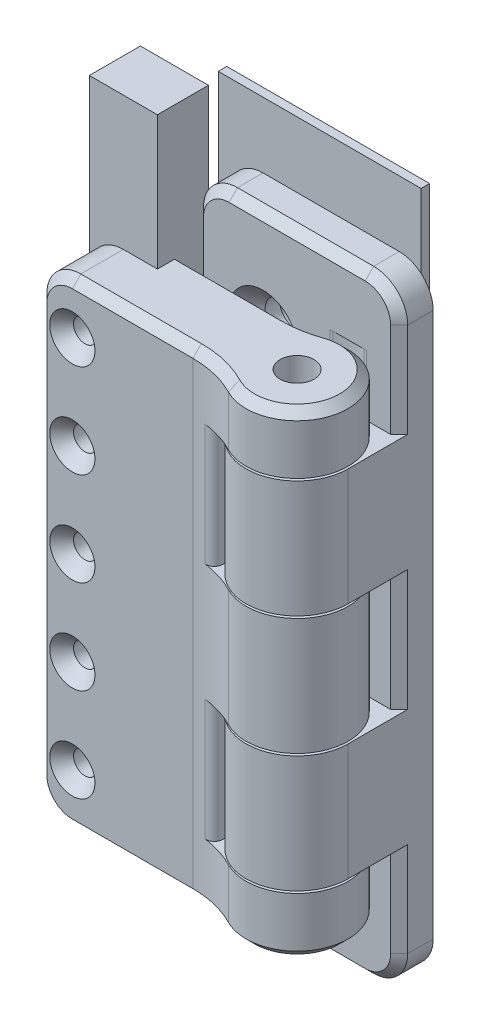
from build123d import *
from build123d.topology import SkipClean

# Parameters (mm, degrees)
SKETCH1_W                                     = 37.846
SKETCH1_H                                     = 114.3
BOSS_EXTRUDE1_DEPTH                           = 1.5875
SKETCH2_R                                     = 6.0706
CUT_EXTRUDE1_DEPTH                            = 69.563564466
CUT_EXTRUDE2_DEPTH                            = 69.563564466
BOSS_EXTRUDE2_REACH                           = 70.564
SKETCH4_W                                     = 12.7
SKETCH4_H                                     = 9.525
BOSS_EXTRUDE2_DIRECTION_2_REACH               = 70.564
SKETCH6_W                                     = 38.1
SKETCH6_H                                     = 114.3
BOSS_EXTRUDE3_DEPTH                           = 6.35
SKETCH7_R                                     = 5.5626
BOSS_EXTRUDE4_DEPTH                           = 3.175
FILLET2_R                                     = 0.762
CSK_FOR_1_4_FLAT_HEAD_MACHINE_SCREW1_AT_COUNT = 2
CSK_FOR_1_4_FLAT_HEAD_MACHINE_SCREW1_AT_PITCH = 38.1
CSK_FOR_1_4_FLAT_HEAD_MACHINE_SCREW1_2_COUNT  = 2
CSK_FOR_1_4_FLAT_HEAD_MACHINE_SCREW1_2_PITCH  = 76.2
BOSS_EXTRUDE8_DEPTH                           = 44.45
BOSS_EXTRUDE9_DEPTH                           = 44.45
BOSS_EXTRUDE12_DEPTH                          = 88.9
CSK_FOR_8_FLAT_HEAD_MACHINE_SCREW2_AT_2_COUNT = 2
CSK_FOR_8_FLAT_HEAD_MACHINE_SCREW2_AT_2_PITCH = 17.4625
CSK_FOR_8_FLAT_HEAD_MACHINE_SCREW2_AT_3_COUNT = 2
CSK_FOR_8_FLAT_HEAD_MACHINE_SCREW2_AT_3_PITCH = 34.925
CSK_FOR_8_FLAT_HEAD_MACHINE_SCREW2_AT_4_COUNT = 2
CSK_FOR_8_FLAT_HEAD_MACHINE_SCREW2_AT_4_PITCH = 52.3875
CSK_FOR_8_FLAT_HEAD_MACHINE_SCREW2_AT_5_COUNT = 2
CSK_FOR_8_FLAT_HEAD_MACHINE_SCREW2_AT_5_PITCH = 69.85
SKETCH20_R                                    = 3.175
CUT_EXTRUDE6_DEPTH                            = 85.725
SKETCH23_W                                    = 19.05
SKETCH23_H                                    = 11.1125
BOSS_EXTRUDE10_DEPTH                          = 19.05
SKETCH23_H_2                                  = 22.225
BOSS_EXTRUDE10_2_DEPTH                        = 19.05
BOSS_EXTRUDE10_3_DEPTH                        = 19.05
SKETCH24_R                                    = 10.033
BOSS_EXTRUDE11_DEPTH                          = 11.1125
LPATTERN3_COUNT                               = 3
LPATTERN3_PITCH                               = 22.225
LPATTERN3_2_COUNT                             = 3
LPATTERN3_2_PITCH                             = 22.225
SKETCH25_OUTSIDE_W                            = 81.954
SKETCH25_OUTSIDE_H                            = 156.515
SKETCH25_OUTSIDE_W_2                          = 51.9811
SKETCH25_OUTSIDE_H_2                          = 88.9
CUT_EXTRUDE7_DEPTH                            = 85.475623046
FILLET7_R                                     = 1.5875
FILLET8_R                                     = 1.5875
FILLET5_R                                     = 6.35
FILLET6_R                                     = 6.35
CHAMFER5_SIZE                                 = 1.5875
CHAMFER6_SIZE                                 = 1.5875
MOVE_START                                    = -23.5553
MOVE_FACE3_OUTLINE_R                          = 3.175
MOVE_FACE3_DEPTH                              = 22.625
MOVE_START_2                                  = -45.5803
MOVE_FACE3_2_OUTLINE_R                        = 3.175
MOVE_FACE3_2_DEPTH                            = 0.2
MOVE_START_3                                  = 20.8947
MOVE_FACE3_3_OUTLINE_R                        = 3.175
MOVE_FACE3_3_DEPTH                            = 0.2
MOVE_START_4                                  = -45.7803
MOVE_FACE4_OUTLINE_R                          = 3.175
MOVE_FACE4_DEPTH                              = 22.625
MOVE_START_5                                  = -1.3303
MOVE_FACE4_2_OUTLINE_R                        = 3.175
MOVE_FACE4_2_DEPTH                            = 22.625


with BuildPart() as part:
    # Sketch1 → Boss-Extrude1 (new body)
    with BuildSketch(Plane.XY):
        with Locations((18.923, 0)):
            Rectangle(SKETCH1_W, SKETCH1_H)
    extrude(amount=-BOSS_EXTRUDE1_DEPTH)

    # Sketch2 → Cut-Extrude1 (cut, through all)
    with BuildSketch(Plane.XY):
        with Locations((14.7066, 38.1254)):
            Circle(SKETCH2_R)
        with Locations((14.7066, 0.0254)):
            Circle(SKETCH2_R)
        with Locations((14.7066, -38.0746)):
            Circle(SKETCH2_R)
    extrude(amount=-CUT_EXTRUDE1_DEPTH, mode=Mode.SUBTRACT)

    # Sketch3 → Cut-Extrude2 (cut, through all)
    with BuildSketch(Plane.XY):
        with BuildLine():
            Line((18.4912, 38.1254), (18.4912, 25.8572))
            ThreePointArc((18.4912, 25.8572), (14.7066, 22.0726), (10.922, 25.8572))
            Line((10.922, 25.8572), (10.922, 38.1254))
            ThreePointArc((10.922, 38.1254), (14.7066, 41.91), (18.4912, 38.1254))
        make_face()
        with BuildLine():
            Line((18.4912, 0.0254), (18.4912, -12.2428))
            ThreePointArc((18.4912, -12.2428), (14.7066, -16.0274), (10.922, -12.2428))
            Line((10.922, -12.2428), (10.922, 0.0254))
            ThreePointArc((10.922, 0.0254), (14.7066, 3.81), (18.4912, 0.0254))
        make_face()
        with BuildLine():
            Line((18.4912, -38.0746), (18.4912, -50.3428))
            ThreePointArc((18.4912, -50.3428), (14.7066, -54.1274), (10.922, -50.3428))
            Line((10.922, -50.3428), (10.922, -38.0746))
            ThreePointArc((10.922, -38.0746), (14.7066, -34.29), (18.4912, -38.0746))
        make_face()
    extrude(amount=-CUT_EXTRUDE2_DEPTH, mode=Mode.SUBTRACT)


with BuildPart() as body_2:

    # Boss-Extrude2: up to this face of the body (flat: up to its plane)
    boss_extrude2_end = Plane(part.part.faces().sort_by_distance((18.923, 57.15, -0.79375))[0])
    # Sketch4 → Boss-Extrude2 (new, up to the picked face)
    with BuildSketch(Plane(origin=(0, 0, 0), x_dir=(1, 0, 0), z_dir=(0, 1, 0)), mode=Mode.PRIVATE) as boss_extrude2_sk1:
        with Locations((-5.0165, -7.9375)):
            Rectangle(SKETCH4_W, SKETCH4_H)
    boss_extrude2_tool1 = split(extrude(boss_extrude2_sk1.sketch, amount=BOSS_EXTRUDE2_REACH, mode=Mode.PRIVATE), bisect_by=boss_extrude2_end, keep=Keep.BOTH, mode=Mode.PRIVATE)
    add(boss_extrude2_tool1.solids().sort_by(Axis((-5.0165, 0, 7.9375), (0, 1, 0)))[0])


    # Boss-Extrude2 direction 2: up to this face of the body (flat: up to its plane)
    boss_extrude2_direction_2_end = Plane(part.part.faces().sort_by_distance((18.923, -57.15, -0.79375))[0])
    # Sketch4 → Boss-Extrude2 direction 2 (add, up to the picked face)
    with BuildSketch(Plane(origin=(0, 0, 0), x_dir=(1, 0, 0), z_dir=(0, 1, 0)), mode=Mode.PRIVATE) as boss_extrude2_direction_2_sk1:
        with Locations((-5.0165, -7.9375)):
            Rectangle(SKETCH4_W, SKETCH4_H)
    boss_extrude2_direction_2_tool1 = split(extrude(boss_extrude2_direction_2_sk1.sketch, amount=-BOSS_EXTRUDE2_DIRECTION_2_REACH, mode=Mode.PRIVATE), bisect_by=boss_extrude2_direction_2_end, keep=Keep.BOTH, mode=Mode.PRIVATE)
    add(boss_extrude2_direction_2_tool1.solids().sort_by(Axis((-5.0165, 0, 7.9375), (0, -1, 0)))[0])


with BuildPart() as body_3:
    # Sketch6 → Boss-Extrude3 (new body)
    with BuildSketch(Plane.XY):
        with Locations((21.0566, -12.2428)):
            Rectangle(SKETCH6_W, SKETCH6_H)
    extrude(amount=BOSS_EXTRUDE3_DEPTH)

    # Sketch7 → Boss-Extrude4 (add)
    with BuildSketch(Plane(origin=(0, 0, 0), x_dir=(-1, 0, 0), z_dir=(0, 0, -1))):
        with Locations((-14.7066, 0.0254)):
            Circle(SKETCH7_R)
        with Locations((-14.7066, -38.0746)):
            Circle(SKETCH7_R)
        with Locations((-14.7066, 38.1254)):
            Circle(SKETCH7_R)
    extrude(amount=BOSS_EXTRUDE4_DEPTH)

    # Fillet2
    fillet2_edges = [body_3.edges().sort_by_distance(p)[0] for p in [
        (20.2692, 0.0254, 0),
        (20.2692, -38.0746, 0),
        (20.2692, 38.1254, 0),
    ]]
    fillet(fillet2_edges, radius=FILLET2_R)

    # Sketch9 → CSK for 1/4 Flat Head Machine Screw1 (revolve, cut)
    with BuildSketch(Plane(origin=(14.7066, 25.8572, 6.35), x_dir=(0, -1, 0), z_dir=(1, 0, 0))):
        Polygon((0, 0), (0, 9.525), (3.2639, 9.525), (3.2639, 3.652419693), (6.4389, 0), align=None)
    csk_for_1_4_flat_head_machine_screw1 = revolve(axis=Axis((14.7066, 25.8572, 12.7), (0, 0, -1)), mode=Mode.SUBTRACT)

    # CSK for 1/4 Flat Head Machine Screw1 at: CSK for 1/4 Flat Head Machine Screw1 ×2
    with Locations(*[(0, -i * CSK_FOR_1_4_FLAT_HEAD_MACHINE_SCREW1_AT_PITCH, 0) for i in range(1, CSK_FOR_1_4_FLAT_HEAD_MACHINE_SCREW1_AT_COUNT)]):
        add(csk_for_1_4_flat_head_machine_screw1, mode=Mode.SUBTRACT)

    # CSK for 1_4 Flat Head Machine Screw1 2: CSK for 1/4 Flat Head Machine Screw1 ×2
    with Locations(*[(0, -i * CSK_FOR_1_4_FLAT_HEAD_MACHINE_SCREW1_2_PITCH, 0) for i in range(1, CSK_FOR_1_4_FLAT_HEAD_MACHINE_SCREW1_2_COUNT)]):
        add(csk_for_1_4_flat_head_machine_screw1, mode=Mode.SUBTRACT)

    # Sketch18 → Boss-Extrude8 (add, symmetric)
    with BuildSketch(Plane(origin=(0, -12.2428, 0), x_dir=(1, 0, 0), z_dir=(0, 1, 0))):
        with BuildLine():
            Line((21.0566, -6.35), (21.0566, -15.875))
            ThreePointArc((21.0566, -15.875), (30.5816, -25.4), (40.1066, -15.875))
            Line((40.1066, -15.875), (40.1066, -6.35))
            Line((40.1066, -6.35), (21.0566, -6.35))
        make_face()
    extrude(amount=BOSS_EXTRUDE8_DEPTH, both=True)


with BuildPart() as body_4:
    # Sketch19 → Boss-Extrude9 (new, symmetric)
    with BuildSketch(Plane(origin=(0, -12.2428, 0), x_dir=(1, 0, 0), z_dir=(0, 1, 0))):
        with BuildLine():
            Line((-11.3665, -12.7), (-11.3665, -22.225))
            Line((-11.3665, -22.225), (17.490739639, -22.225))
            ThreePointArc((17.490739639, -22.225), (21.980867699, -22.761727734), (26.21797988, -24.341666667))
            ThreePointArc((26.21797988, -24.341666667), (40.057194918, -14.906121289), (24.594762586, -8.466666667))
            ThreePointArc((24.594762586, -8.466666667), (18.971087758, -11.610512242), (12.621087758, -12.7))
            Line((12.621087758, -12.7), (-11.3665, -12.7))
        make_face()
    extrude(amount=BOSS_EXTRUDE9_DEPTH, both=True)

    # Sketch26 → Boss-Extrude12 (add)
    with BuildSketch(Plane(origin=(0, 32.2072, 0), x_dir=(1, 0, 0), z_dir=(0, 1, 0))):
        with BuildLine():
            Line((1.3335, -15.875), (1.3335, -7.9375))
            Line((1.3335, -7.9375), (21.189823344, -7.9375))
            ThreePointArc((21.189823344, -7.9375), (24.364823344, -7.671053311), (27.451007781, -6.879166667))
            Line((27.451007781, -6.879166667), (30.5816, -15.875))
            Line((30.5816, -15.875), (1.3335, -15.875))
        make_face()
    extrude(amount=-BOSS_EXTRUDE12_DEPTH)


with BuildPart() as csk_for_8_flat_head_machine_screw2_tool:
    # Sketch22 → CSK for #8 Flat Head Machine Screw2 (revolve)
    with BuildSketch(Plane(origin=(-5.0165, -47.1678, 22.225), x_dir=(0, -1, 0), z_dir=(1, 0, 0))):
        Polygon((0, 0), (0, 25.4), (2.15265, 25.4), (2.15265, 2.3740728), (4.2164, 0), align=None)
    csk_for_8_flat_head_machine_screw2 = revolve(axis=Axis((-5.0165, -47.1678, 28.575), (0, 0, -1)))


with BuildPart() as body_2_1:
    add(body_2.part)

    # CSK for #8 Flat Head Machine Screw2: cut by csk_for_8_flat_head_machine_screw2_tool
    add(csk_for_8_flat_head_machine_screw2_tool.part, mode=Mode.SUBTRACT)


with BuildPart() as body_4_1:
    add(body_4.part)

    # CSK for #8 Flat Head Machine Screw2: cut by csk_for_8_flat_head_machine_screw2_tool
    add(csk_for_8_flat_head_machine_screw2_tool.part, mode=Mode.SUBTRACT)


with BuildPart() as csk_for_8_flat_head_machine_screw2_at_2_tool:
    # CSK for #8 Flat Head Machine Screw2 at 2: CSK for #8 Flat Head Machine Screw2 ×2
    with Locations(*[(0, i * CSK_FOR_8_FLAT_HEAD_MACHINE_SCREW2_AT_2_PITCH, 0) for i in range(1, CSK_FOR_8_FLAT_HEAD_MACHINE_SCREW2_AT_2_COUNT)]):
        add(csk_for_8_flat_head_machine_screw2)


with BuildPart() as body_2_2:
    add(body_2_1.part)

    # CSK for #8 Flat Head Machine Screw2 at 2: cut by csk_for_8_flat_head_machine_screw2_at_2_tool
    add(csk_for_8_flat_head_machine_screw2_at_2_tool.part, mode=Mode.SUBTRACT)


with BuildPart() as body_4_2:
    add(body_4_1.part)

    # CSK for #8 Flat Head Machine Screw2 at 2: cut by csk_for_8_flat_head_machine_screw2_at_2_tool
    add(csk_for_8_flat_head_machine_screw2_at_2_tool.part, mode=Mode.SUBTRACT)


with BuildPart() as csk_for_8_flat_head_machine_screw2_at_3_tool:
    # CSK for #8 Flat Head Machine Screw2 at 3: CSK for #8 Flat Head Machine Screw2 ×2
    with Locations(*[(0, i * CSK_FOR_8_FLAT_HEAD_MACHINE_SCREW2_AT_3_PITCH, 0) for i in range(1, CSK_FOR_8_FLAT_HEAD_MACHINE_SCREW2_AT_3_COUNT)]):
        add(csk_for_8_flat_head_machine_screw2)


with BuildPart() as body_2_3:
    add(body_2_2.part)

    # CSK for #8 Flat Head Machine Screw2 at 3: cut by csk_for_8_flat_head_machine_screw2_at_3_tool
    add(csk_for_8_flat_head_machine_screw2_at_3_tool.part, mode=Mode.SUBTRACT)


with BuildPart() as body_4_3:
    add(body_4_2.part)

    # CSK for #8 Flat Head Machine Screw2 at 3: cut by csk_for_8_flat_head_machine_screw2_at_3_tool
    add(csk_for_8_flat_head_machine_screw2_at_3_tool.part, mode=Mode.SUBTRACT)


with BuildPart() as csk_for_8_flat_head_machine_screw2_at_4_tool:
    # CSK for #8 Flat Head Machine Screw2 at 4: CSK for #8 Flat Head Machine Screw2 ×2
    with Locations(*[(0, i * CSK_FOR_8_FLAT_HEAD_MACHINE_SCREW2_AT_4_PITCH, 0) for i in range(1, CSK_FOR_8_FLAT_HEAD_MACHINE_SCREW2_AT_4_COUNT)]):
        add(csk_for_8_flat_head_machine_screw2)


with BuildPart() as body_2_4:
    add(body_2_3.part)

    # CSK for #8 Flat Head Machine Screw2 at 4: cut by csk_for_8_flat_head_machine_screw2_at_4_tool
    add(csk_for_8_flat_head_machine_screw2_at_4_tool.part, mode=Mode.SUBTRACT)


with BuildPart() as body_4_4:
    add(body_4_3.part)

    # CSK for #8 Flat Head Machine Screw2 at 4: cut by csk_for_8_flat_head_machine_screw2_at_4_tool
    add(csk_for_8_flat_head_machine_screw2_at_4_tool.part, mode=Mode.SUBTRACT)


with BuildPart() as csk_for_8_flat_head_machine_screw2_at_5_tool:
    # CSK for #8 Flat Head Machine Screw2 at 5: CSK for #8 Flat Head Machine Screw2 ×2
    with Locations(*[(0, i * CSK_FOR_8_FLAT_HEAD_MACHINE_SCREW2_AT_5_PITCH, 0) for i in range(1, CSK_FOR_8_FLAT_HEAD_MACHINE_SCREW2_AT_5_COUNT)]):
        add(csk_for_8_flat_head_machine_screw2)


with BuildPart() as body_2_5:
    add(body_2_4.part)

    # CSK for #8 Flat Head Machine Screw2 at 5: cut by csk_for_8_flat_head_machine_screw2_at_5_tool
    add(csk_for_8_flat_head_machine_screw2_at_5_tool.part, mode=Mode.SUBTRACT)


with BuildPart() as body_4_5:
    add(body_4_4.part)

    # CSK for #8 Flat Head Machine Screw2 at 5: cut by csk_for_8_flat_head_machine_screw2_at_5_tool
    add(csk_for_8_flat_head_machine_screw2_at_5_tool.part, mode=Mode.SUBTRACT)


with BuildPart() as cut_extrude6_tool:
    # Sketch20 → Cut-Extrude6 (new body)
    with BuildSketch(Plane(origin=(0, 32.2072, 0), x_dir=(1, 0, 0), z_dir=(0, 1, 0))):
        with Locations(Location((30.5816, -15.875, 0), (0, 0, 180))):
            Circle(SKETCH20_R)
    extrude(amount=-CUT_EXTRUDE6_DEPTH)


with BuildPart() as body_3_1:
    add(body_3.part)

    # Cut-Extrude6: cut by cut_extrude6_tool
    add(cut_extrude6_tool.part, mode=Mode.SUBTRACT)


with BuildPart() as body_4_6:
    add(body_4_5.part)

    # Cut-Extrude6: cut by cut_extrude6_tool
    add(cut_extrude6_tool.part, mode=Mode.SUBTRACT)


with BuildPart() as body_5:
    # Sketch23 → Boss-Extrude10 (new body)
    with BuildSketch(Plane.XY.offset(6.35)):
        with Locations((30.5816, 26.65095)):
            Rectangle(SKETCH23_W, SKETCH23_H)
    extrude(amount=BOSS_EXTRUDE10_DEPTH)


with BuildPart() as body_6:
    # Sketch23 → Boss-Extrude10 2 (new body)
    with BuildSketch(Plane.XY.offset(6.35)):
        with Locations((30.5816, -12.2428)):
            Rectangle(SKETCH23_W, SKETCH23_H_2)
    extrude(amount=BOSS_EXTRUDE10_2_DEPTH)


with BuildPart() as body_7:
    # Sketch23 → Boss-Extrude10 3 (new body)
    with BuildSketch(Plane.XY.offset(6.35)):
        with Locations((30.5816, -51.13655)):
            Rectangle(SKETCH23_W, SKETCH23_H)
    extrude(amount=BOSS_EXTRUDE10_3_DEPTH)


with BuildPart() as body_3_2:
    add(body_3_1.part)

    # Intersect1: read off the stored shape, not the designer's step
    # Intersect1: cut body 7, body 6, body 5
    add(body_7.part, mode=Mode.SUBTRACT)
    add(body_6.part, mode=Mode.SUBTRACT)
    add(body_5.part, mode=Mode.SUBTRACT)


with BuildPart() as body_5_2:
    # Sketch24 → Boss-Extrude11 (new, symmetric)
    with BuildSketch(Plane(origin=(0, -12.2428, 0), x_dir=(1, 0, 0), z_dir=(0, 1, 0))):
        with Locations(Location((30.5816, -15.875, 0), (0, 0, 180))):
            Circle(SKETCH24_R)
    extrude(amount=BOSS_EXTRUDE11_DEPTH, both=True)


with BuildPart() as lpattern3_1:
    # LPattern3: pattern copy
    add(body_5_2.part.moved(Location(Vector(0, 1, 0) * (1 * LPATTERN3_PITCH))))


with BuildPart() as lpattern3_2:
    # LPattern3: pattern copy
    add(body_5_2.part.moved(Location(Vector(0, 1, 0) * (2 * LPATTERN3_PITCH))))


with BuildPart() as lpattern3_2_1:
    # LPattern3 2: pattern copy
    add(body_5_2.part.moved(Location(Vector(0, -1, 0) * (1 * LPATTERN3_2_PITCH))))


with BuildPart() as lpattern3_2_2:
    # LPattern3 2: pattern copy
    add(body_5_2.part.moved(Location(Vector(0, -1, 0) * (2 * LPATTERN3_2_PITCH))))


with BuildPart() as cut_extrude7_tool:
    # Sketch25 outside → Cut-Extrude7 (new, through all)
    with BuildSketch(Plane.XY):
        with Locations((14.624, -6.1215)):
            Rectangle(SKETCH25_OUTSIDE_W, SKETCH25_OUTSIDE_H)
        with Locations((14.62405, -12.2428)):
            Rectangle(SKETCH25_OUTSIDE_W_2, SKETCH25_OUTSIDE_H_2, mode=Mode.SUBTRACT)
    extrude(amount=CUT_EXTRUDE7_DEPTH)


with BuildPart() as lpattern3_2_3:
    add(lpattern3_2.part)

    # Cut-Extrude7: cut by cut_extrude7_tool
    add(cut_extrude7_tool.part, mode=Mode.SUBTRACT)


with BuildPart() as lpattern3_2_2_1:
    add(lpattern3_2_2.part)

    # Cut-Extrude7: cut by cut_extrude7_tool
    add(cut_extrude7_tool.part, mode=Mode.SUBTRACT)


with BuildPart() as body_3_3:
    add(body_3_2.part)

    # Intersect2: read off the stored shape, not the designer's step
    # Intersect2: cut LPattern3 2_2, body 5 2, LPattern3_2
    add(lpattern3_2_2_1.part, mode=Mode.SUBTRACT)
    add(body_5_2.part, mode=Mode.SUBTRACT)
    add(lpattern3_2_3.part, mode=Mode.SUBTRACT)

    # Fillet8
    fillet8_edges = [body_3_3.edges().sort_by_distance(p)[0] for p in [
        (33.733657106, 26.65095, 6.35),
        (27.429542894, 26.65095, 6.35),
        (33.733657106, -12.2428, 6.35),
        (27.429542894, -12.2428, 6.35),
        (33.733657106, -51.13655, 6.35),
        (27.429542894, -51.13655, 6.35),
    ]]
    fillet(fillet8_edges, radius=FILLET8_R)

    # Fillet5
    fillet5_edges = [body_3_3.edges().sort_by_distance(p)[0] for p in [
        (40.1066, 44.9072, 3.175),
        (2.0066, 44.9072, 3.175),
        (2.0066, -69.3928, 3.175),
        (40.1066, -69.3928, 3.175),
    ]]
    fillet(fillet5_edges, radius=FILLET5_R)

    # Chamfer6
    chamfer6_edges = [body_3_3.edges().sort_by_distance(p)[0] for p in [
        (21.0566, -69.3928, 6.35),
        (2.0066, -12.2428, 6.35),
        (21.0566, 44.9072, 6.35),
        (40.1066, -54.31155, 6.35),
        (38.246728061, 43.047328061, 6.35),
        (3.866471939, 43.047328061, 6.35),
        (38.246728061, -67.532928061, 6.35),
        (3.866471939, -67.532928061, 6.35),
        (40.1066, -12.2428, 6.35),
        (40.1066, 29.82595, 6.35),
    ]]
    chamfer(chamfer6_edges, length=CHAMFER6_SIZE)

    # Move Face3: read off the stored shape, not the designer's step
    # Move Face3 outline → Move Face3 (cut)
    with BuildSketch(Plane(origin=(0, 0, 0), x_dir=(1, 0, 0), z_dir=(0, 1, 0)).offset(MOVE_START)):
        with BuildLine():
            ThreePointArc((33.515641345, -6.280601093), (30.5816, -5.842), (27.647558655, -6.280601093))
            ThreePointArc((27.647558655, -6.280601093), (27.41801436, -6.332554415), (27.183311607, -6.35))
            Line((27.183311607, -6.35), (21.0566, -6.35))
            Line((21.0566, -6.35), (21.0566, -15.875))
            ThreePointArc((21.0566, -15.875), (30.5816, -25.4), (40.1066, -15.875))
            Line((40.1066, -15.875), (40.1066, -4.7625))
            Line((40.1066, -4.7625), (38.5191, -6.35))
            Line((38.5191, -6.35), (33.979888393, -6.35))
            ThreePointArc((33.979888393, -6.35), (33.74518564, -6.332554415), (33.515641345, -6.280601093))
        make_face()
        with Locations((30.5816, -15.875)):
            Circle(MOVE_FACE3_OUTLINE_R, mode=Mode.SUBTRACT)
    extrude(amount=MOVE_FACE3_DEPTH, mode=Mode.SUBTRACT)

    # Move Face3 2 outline → Move Face3 2 (cut)
    with BuildSketch(Plane(origin=(0, 0, 0), x_dir=(1, 0, 0), z_dir=(0, 1, 0)).offset(MOVE_START_2)):
        with BuildLine():
            ThreePointArc((33.515641345, -6.280601093), (30.5816, -5.842), (27.647558655, -6.280601093))
            ThreePointArc((27.647558655, -6.280601093), (27.41801436, -6.332554415), (27.183311607, -6.35))
            Line((27.183311607, -6.35), (21.0566, -6.35))
            Line((21.0566, -6.35), (21.0566, -15.875))
            ThreePointArc((21.0566, -15.875), (30.5816, -25.4), (40.1066, -15.875))
            Line((40.1066, -15.875), (40.1066, -4.7625))
            Line((40.1066, -4.7625), (38.5191, -6.35))
            Line((38.5191, -6.35), (33.979888393, -6.35))
            ThreePointArc((33.979888393, -6.35), (33.74518564, -6.332554415), (33.515641345, -6.280601093))
        make_face()
        with Locations((30.5816, -15.875)):
            Circle(MOVE_FACE3_2_OUTLINE_R, mode=Mode.SUBTRACT)
    extrude(amount=MOVE_FACE3_2_DEPTH, mode=Mode.SUBTRACT)

    # Move Face3 3 outline → Move Face3 3 (cut)
    with BuildSketch(Plane(origin=(0, 0, 0), x_dir=(1, 0, 0), z_dir=(0, 1, 0)).offset(MOVE_START_3)):
        with BuildLine():
            ThreePointArc((33.515641345, -6.280601093), (30.5816, -5.842), (27.647558655, -6.280601093))
            ThreePointArc((27.647558655, -6.280601093), (27.41801436, -6.332554415), (27.183311607, -6.35))
            Line((27.183311607, -6.35), (21.0566, -6.35))
            Line((21.0566, -6.35), (21.0566, -15.875))
            ThreePointArc((21.0566, -15.875), (30.5816, -25.4), (40.1066, -15.875))
            Line((40.1066, -15.875), (40.1066, -4.7625))
            Line((40.1066, -4.7625), (38.5191, -6.35))
            Line((38.5191, -6.35), (33.979888393, -6.35))
            ThreePointArc((33.979888393, -6.35), (33.74518564, -6.332554415), (33.515641345, -6.280601093))
        make_face()
        with Locations((30.5816, -15.875)):
            Circle(MOVE_FACE3_3_OUTLINE_R, mode=Mode.SUBTRACT)
    extrude(amount=MOVE_FACE3_3_DEPTH, mode=Mode.SUBTRACT)


with BuildPart() as body_4_7:
    add(body_4_6.part)

    # Intersect3: read off the stored shape, not the designer's step
    # Intersect3: cut LPattern3 2_1, LPattern3_1
    add(lpattern3_2_1.part, mode=Mode.SUBTRACT)
    add(lpattern3_1.part, mode=Mode.SUBTRACT)

    # Fillet7
    # the kernel refuses this fillet: 1.5875 mm, written as the material it takes off along each edge
    with BuildSketch(Plane(origin=(24.968756894, -45.5803, 7.558926331), x_dir=(-0.7015732440189187, 0, 0.7125973500349062), z_dir=(0, 1, 0)), Plane(origin=(24.968756894, -1.1303, 7.558926331), x_dir=(-0.7015732440189183, 0, 0.7125973500349067), z_dir=(0, 1, 0))) as fillet7_piece_1:
        with BuildLine():
            CenterArc((4.290970292, -1.556017706), FILLET7_R, 101.429685754, 123.123676509)
            Line((3.159721999, -2.669765231), (3.04659717, -2.781139984))
            ThreePointArc((3.04659717, -2.781139984), (2.807844434, -2.538635629), (-0.088783419, -0.131601926))
            Line((-0.088783419, -0.131601926), (0.031458726, 0.155601771))
            ThreePointArc((0.031458726, 0.155601771), (1.988191514, -0.040218095), (3.944924301, 0.155601771))
            Line((3.944924301, 0.155601771), (3.976383027, 0))
        make_face()
    extrude(amount=22.225, mode=Mode.SUBTRACT)
    with BuildSketch(Plane(origin=(23.855877584, -1.1303, 23.319847009), x_dir=(-0.594593054161878, 0, -0.8040268030000305), z_dir=(0, 1, 0)), Plane(origin=(23.855877584, -45.5803, 23.319847009), x_dir=(-0.5945930541618822, 0, -0.8040268030000275), z_dir=(0, 1, 0))) as fillet7_piece_2:
        with BuildLine():
            CenterArc((4.287942715, 1.556062565), FILLET7_R, 136.378278382, 122.200208886)
            ThreePointArc((3.13873501, 2.65126935), (1.641053557, 1.240768337), (0, 0))
            ThreePointArc((0, 0), (1.986788707, 0.198684587), (3.973577413, 0))
        make_face()
    extrude(amount=22.225, mode=Mode.SUBTRACT)

    # Fillet6
    fillet6_edges = [body_4_7.edges().sort_by_distance(p)[0] for p in [
        (-11.3665, -56.6928, 17.4625),
        (-11.3665, 32.2072, 17.4625),
    ]]
    fillet(fillet6_edges, radius=FILLET6_R)

    # Chamfer5
    chamfer5_edges = [body_4_7.edges().sort_by_distance(p)[0] for p in [
        (6.237119819, 32.2072, 22.225),
        (6.237119819, -56.6928, 22.225),
        (-11.3665, -12.2428, 22.225),
        (-9.506628061, -54.832928061, 22.225),
        (-9.506628061, 30.347328061, 22.225),
        (24.364823344, 32.2072, 7.671053311),
        (11.261661672, 32.2072, 7.9375),
        (24.364823344, -56.6928, 7.671053311),
        (11.261661672, -56.6928, 7.9375),
        (21.980867699, -56.6928, 22.761727734),
        (40.082943653, -56.6928, 16.545890298),
        (21.980867699, 32.2072, 22.761727734),
        (40.082943653, 32.2072, 16.545890298),
    ]]
    chamfer(chamfer5_edges, length=CHAMFER5_SIZE)

    # Move Face4: read off the stored shape, not the designer's step
    # Move Face4 outline → Move Face4 (cut)
    with SkipClean():  # the faces are left unmerged after this step: merging them gives an invalid solid
        with BuildSketch(Plane(origin=(0, 0, 0), x_dir=(1, 0, 0), z_dir=(0, 1, 0)).offset(MOVE_START_4)):
            with BuildLine():
                ThreePointArc((27.451007781, -6.879166667), (24.364823344, -7.671053311), (21.189823344, -7.9375))
                Line((21.189823344, -7.9375), (20.849512852, -7.9375))
                ThreePointArc((20.849512852, -7.9375), (22.24545175, -8.769016638), (22.179032954, -10.392486339))
                ThreePointArc((22.179032954, -10.392486339), (20.573417317, -15.169756508), (21.493216054, -20.124984265))
                ThreePointArc((21.493216054, -20.124984265), (21.338876119, -21.731410575), (19.857915929, -22.372646273))
                ThreePointArc((19.857915929, -22.372646273), (23.12463526, -23.077150673), (26.21797988, -24.341666667))
                ThreePointArc((26.21797988, -24.341666667), (40.082943653, -16.545890298), (27.451007781, -6.879166667))
            make_face()
            with Locations((30.5816, -15.875)):
                Circle(MOVE_FACE4_OUTLINE_R, mode=Mode.SUBTRACT)
        extrude(amount=MOVE_FACE4_DEPTH, mode=Mode.SUBTRACT)

    # Move Face4 2 outline → Move Face4 2 (cut)
    with SkipClean():  # the faces are left unmerged after this step: merging them gives an invalid solid
        with BuildSketch(Plane(origin=(0, 0, 0), x_dir=(1, 0, 0), z_dir=(0, 1, 0)).offset(MOVE_START_5)):
            with BuildLine():
                ThreePointArc((27.451007781, -6.879166667), (24.364823344, -7.671053311), (21.189823344, -7.9375))
                Line((21.189823344, -7.9375), (20.849512852, -7.9375))
                ThreePointArc((20.849512852, -7.9375), (22.24545175, -8.769016638), (22.179032954, -10.392486339))
                ThreePointArc((22.179032954, -10.392486339), (20.573417317, -15.169756508), (21.493216054, -20.124984265))
                ThreePointArc((21.493216054, -20.124984265), (21.338876119, -21.731410575), (19.857915929, -22.372646273))
                ThreePointArc((19.857915929, -22.372646273), (23.12463526, -23.077150673), (26.21797988, -24.341666667))
                ThreePointArc((26.21797988, -24.341666667), (40.082943653, -16.545890298), (27.451007781, -6.879166667))
            make_face()
            with Locations((30.5816, -15.875)):
                Circle(MOVE_FACE4_2_OUTLINE_R, mode=Mode.SUBTRACT)
        extrude(amount=MOVE_FACE4_2_DEPTH, mode=Mode.SUBTRACT)


solid = Compound([part.part, body_2_5.part, body_3_3.part, body_4_7.part])
